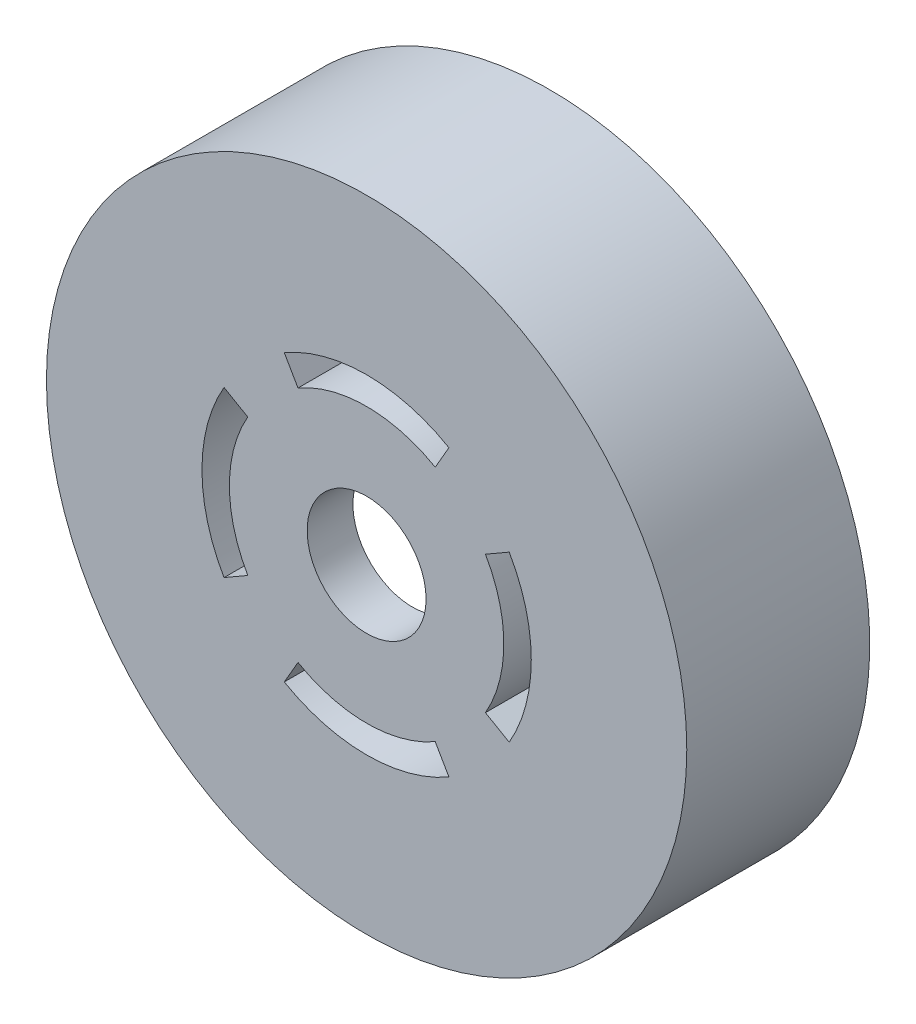
from build123d import *

# Parameters (mm, degrees)
SKETCH_2_R          = 35
SKETCH_2_R_2        = 6.5
EXTRUDE_1_DEPTH     = 5
EXTRUDE_START       = 15
SKETCH_3_R          = 35
SKETCH_3_R_2        = 30.1
EXTRUDE_2_DEPTH     = 15
SKETCH_4_R          = 1.55
CUT_EXTRUDE_1_DEPTH = 10
CUT_EXTRUDE_2_DEPTH = 52.720402164
CUT_EXTRUDE_5_DEPTH = 15
FILLET_1_R          = 1


with BuildPart() as part:
    # 草图2 → 凸台-拉伸1 (new body)
    with BuildSketch(Plane.XY):
        Circle(SKETCH_2_R)
        Circle(SKETCH_2_R_2, mode=Mode.SUBTRACT)
    extrude(amount=EXTRUDE_1_DEPTH)

    # 草图3 → 凸台-拉伸2 (add)
    with BuildSketch(Plane(origin=(0, 0, 0), x_dir=(-1, 0, 0), z_dir=(0, 0, -1)).offset(EXTRUDE_START)):
        Circle(SKETCH_3_R)
        Circle(SKETCH_3_R_2, mode=Mode.SUBTRACT)
    extrude(amount=-EXTRUDE_2_DEPTH)

    # 草图4 → 切除-拉伸1 (cut)
    with BuildSketch(Plane(origin=(0, 0, -15), x_dir=(-1, 0, 0), z_dir=(0, 0, -1))):
        with Locations((0, 32.5)):
            Circle(SKETCH_4_R)
        with Locations((32.5, 0)):
            Circle(SKETCH_4_R)
        with Locations((0, -32.5)):
            Circle(SKETCH_4_R)
        with Locations((-32.5, 0)):
            Circle(SKETCH_4_R)
    extrude(amount=-CUT_EXTRUDE_1_DEPTH, mode=Mode.SUBTRACT)

    # 草图5 → 切除-拉伸2 (cut, through all)
    with BuildSketch(Plane(origin=(0, 0, 0), x_dir=(-1, 0, 0), z_dir=(0, 0, -1))):
        with BuildLine():
            Line((12.990381057, -7.5), (15.588457268, -9))
            ThreePointArc((15.588457268, -9), (18, 0), (15.588457268, 9))
            Line((15.588457268, 9), (12.990381057, 7.5))
            ThreePointArc((12.990381057, 7.5), (15, 0), (12.990381057, -7.5))
        make_face()
        with BuildLine():
            Line((-7.5, 12.990381057), (-9, 15.588457268))
            ThreePointArc((-9, 15.588457268), (0, 18), (9, 15.588457268))
            Line((9, 15.588457268), (7.5, 12.990381057))
            ThreePointArc((7.5, 12.990381057), (0, 15), (-7.5, 12.990381057))
        make_face()
        with BuildLine():
            Line((-7.5, -12.990381057), (-9, -15.588457268))
            ThreePointArc((-9, -15.588457268), (0, -18), (9, -15.588457268))
            Line((9, -15.588457268), (7.5, -12.990381057))
            ThreePointArc((7.5, -12.990381057), (0, -15), (-7.5, -12.990381057))
        make_face()
        with BuildLine():
            Line((-12.990381057, 7.5), (-15.588457268, 9))
            ThreePointArc((-15.588457268, 9), (-18, 0), (-15.588457268, -9))
            Line((-15.588457268, -9), (-12.990381057, -7.5))
            ThreePointArc((-12.990381057, -7.5), (-15, 0), (-12.990381057, 7.5))
        make_face()
    extrude(amount=-CUT_EXTRUDE_2_DEPTH, mode=Mode.SUBTRACT)

    # 草图9 → 切除-拉伸5 (cut)
    with BuildSketch(Plane(origin=(0, 0, -15), x_dir=(-1, 0, 0), z_dir=(0, 0, -1))):
        with BuildLine():
            ThreePointArc((-22.013313369, 20.528615017), (-22.026376234, 22.026376234), (-20.528615017, 22.013313369))
            ThreePointArc((-20.528615017, 22.013313369), (-21.283914114, 21.283914114), (-22.013313369, 20.528615017))
        make_face()
        with BuildLine():
            ThreePointArc((20.528615017, 22.013313369), (22.026376234, 22.026376234), (22.013313369, 20.528615017))
            ThreePointArc((22.013313369, 20.528615017), (21.283914114, 21.283914114), (20.528615017, 22.013313369))
        make_face()
        with BuildLine():
            ThreePointArc((22.013313369, -20.528615017), (22.026376234, -22.026376234), (20.528615017, -22.013313369))
            ThreePointArc((20.528615017, -22.013313369), (21.283914114, -21.283914114), (22.013313369, -20.528615017))
        make_face()
        with BuildLine():
            ThreePointArc((-20.528615017, -22.013313369), (-22.026376234, -22.026376234), (-22.013313369, -20.528615017))
            ThreePointArc((-22.013313369, -20.528615017), (-21.283914114, -21.283914114), (-20.528615017, -22.013313369))
        make_face()
    extrude(amount=-CUT_EXTRUDE_5_DEPTH, mode=Mode.SUBTRACT)

    # 圆角1
    # the kernel refuses this fillet: 1 mm, written as the material it takes off along each edge
    with BuildSketch(Plane(origin=(0, 0, -15), x_dir=(-0.7403558797037455, 0.6722151228498904, 0), z_dir=(-0.6722151228498904, -0.7403558797037455, 0))) as fillet_1_piece_1:
        with BuildLine():
            CenterArc((30.1 + FILLET_1_R, -FILLET_1_R), FILLET_1_R, 90, 90)
            Line((30.1, -FILLET_1_R), (30.1, 0))
            Line((30.1, 0), (30.1 + FILLET_1_R, 0))
        make_face()
    revolve(axis=Axis((0, 0, -15), (0, 0, -1)), revolution_arc=95.523479776, mode=Mode.SUBTRACT)
    with BuildSketch(Plane(origin=(0, 0, -15), x_dir=(0.6722151228498918, 0.7403558797037441, 0), z_dir=(-0.7403558797037441, 0.6722151228498918, 0))) as fillet_1_piece_2:
        with BuildLine():
            CenterArc((30.1 + FILLET_1_R, -FILLET_1_R), FILLET_1_R, 90, 90)
            Line((30.1, -FILLET_1_R), (30.1, 0))
            Line((30.1, 0), (30.1 + FILLET_1_R, 0))
        make_face()
    revolve(axis=Axis((0, 0, -15), (0, 0, -1)), revolution_arc=95.523479776, mode=Mode.SUBTRACT)
    with BuildSketch(Plane(origin=(0, 0, -15), x_dir=(0.7403558797037453, -0.6722151228498905, 0), z_dir=(0.6722151228498905, 0.7403558797037453, 0))) as fillet_1_piece_3:
        with BuildLine():
            CenterArc((30.1 + FILLET_1_R, -FILLET_1_R), FILLET_1_R, 90, 90)
            Line((30.1, -FILLET_1_R), (30.1, 0))
            Line((30.1, 0), (30.1 + FILLET_1_R, 0))
        make_face()
    revolve(axis=Axis((0, 0, -15), (0, 0, -1)), revolution_arc=95.523479776, mode=Mode.SUBTRACT)
    with BuildSketch(Plane(origin=(0, 0, -15), x_dir=(-1, 0, 0), z_dir=(0, -1, 0))) as fillet_1_piece_4:
        with BuildLine():
            CenterArc((30.1 + FILLET_1_R, -FILLET_1_R), FILLET_1_R, 90, 90)
            Line((30.1, -FILLET_1_R), (30.1, 0))
            Line((30.1, 0), (30.1 + FILLET_1_R, 0))
        make_face()
    revolve(axis=Axis((0, 0, -15), (0, 0, -1)), revolution_arc=47.760430641, mode=Mode.SUBTRACT)
    with BuildSketch(Plane(origin=(0, 0, -15), x_dir=(-0.6722320403041436, -0.7403405189428228, 0), z_dir=(0.7403405189428228, -0.6722320403041436, 0))) as fillet_1_piece_5:
        with BuildLine():
            CenterArc((30.1 + FILLET_1_R, -FILLET_1_R), FILLET_1_R, 90, 90)
            Line((30.1, -FILLET_1_R), (30.1, 0))
            Line((30.1, 0), (30.1 + FILLET_1_R, 0))
        make_face()
    revolve(axis=Axis((0, 0, -15), (0, 0, -1)), revolution_arc=47.760430641, mode=Mode.SUBTRACT)


solid = part.part
